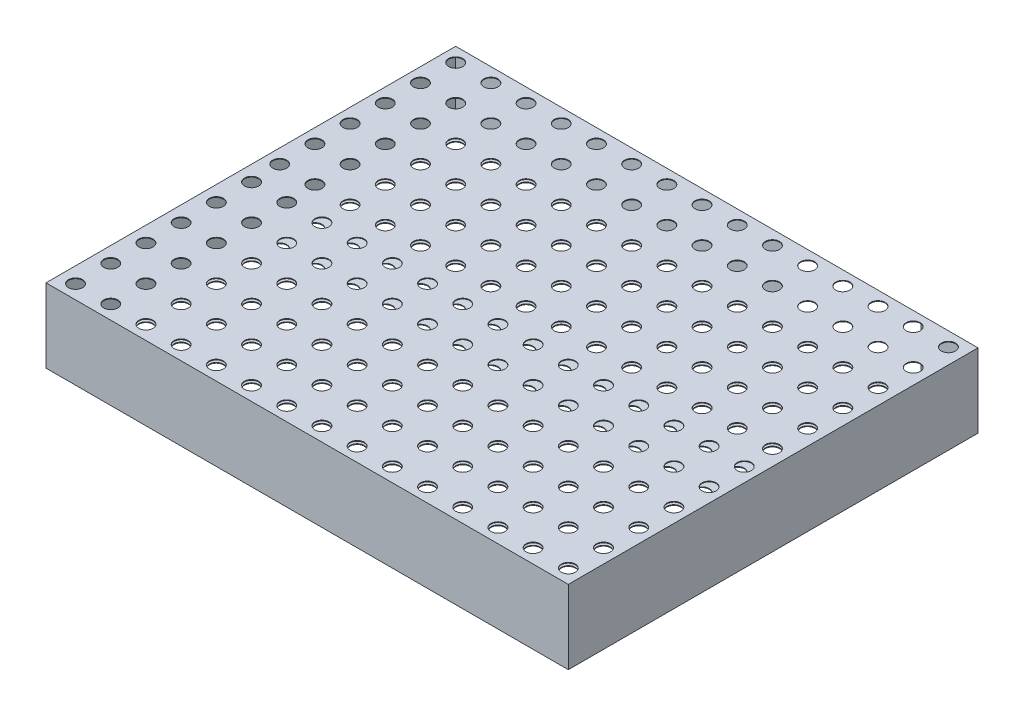
from build123d import *

# Parameters (mm, degrees)
EXTRUDE_1_OUTLINE_W      = 742
EXTRUDE_1_OUTLINE_H      = 582
EXTRUDE_1_DEPTH          = 1
EXTRUDE_START            = 104
EXTRUDE_1_2_OUTLINE_W    = 742
EXTRUDE_1_2_OUTLINE_H    = 582
EXTRUDE_1_2_DEPTH        = 1
EXTRUDE_START_2          = 1
EXTRUDE_1_3_OUTLINE_W    = 742
EXTRUDE_1_3_OUTLINE_H    = 582
EXTRUDE_1_3_OUTLINE_W_2  = 740
EXTRUDE_1_3_OUTLINE_H_2  = 580
EXTRUDE_1_3_DEPTH        = 103
CUT_EXTRUDE_2_DEPTH      = 484.060037676
CUT_EXTRUDE_2_DEPTH_BACK = 484.060037676
SKETCH_5_R               = 10
SKETCH_6_W               = 180
SKETCH_6_H               = 100
CUT_EXTRUDE_3_DEPTH      = 484.060037676


# Read off the part's stored shape, not the designer's step: 拉伸-薄壁1
with BuildPart() as part:
    # 拉伸-薄壁1 outline → 拉伸-薄壁1 (new body)
    with BuildSketch(Plane(origin=(0, 0, 0), x_dir=(1, 0, 0), z_dir=(0, 1, 0))):
        Rectangle(EXTRUDE_1_OUTLINE_W, EXTRUDE_1_OUTLINE_H)
    extrude(amount=EXTRUDE_1_DEPTH)



with BuildPart() as body_2:
    # Extrude 1 2 outline → Extrude 1 2 (new body)
    with BuildSketch(Plane(origin=(0, 0, 0), x_dir=(1, 0, 0), z_dir=(0, 1, 0)).offset(EXTRUDE_START)):
        Rectangle(EXTRUDE_1_2_OUTLINE_W, EXTRUDE_1_2_OUTLINE_H)
    extrude(amount=EXTRUDE_1_2_DEPTH)


with BuildPart() as part_1:
    add(part.part)

    add(body_2.part)  # Extrude 1 3 merges body 2
    # Extrude 1 3 outline → Extrude 1 3 (add)
    with BuildSketch(Plane(origin=(0, 0, 0), x_dir=(1, 0, 0), z_dir=(0, 1, 0)).offset(EXTRUDE_START_2)):
        Rectangle(EXTRUDE_1_3_OUTLINE_W, EXTRUDE_1_3_OUTLINE_H)
        Rectangle(EXTRUDE_1_3_OUTLINE_W_2, EXTRUDE_1_3_OUTLINE_H_2, mode=Mode.SUBTRACT)
    extrude(amount=EXTRUDE_1_3_DEPTH)

    # 草图5 → 切除-拉伸2 (cut, two sides: drawn at the far end of the back side and taken through both)
    with BuildSketch(Plane(origin=(0, 0, 0), x_dir=(1, 0, 0), z_dir=(0, 1, 0)).offset(-CUT_EXTRUDE_2_DEPTH_BACK)):
        with Locations(Location((-351, 271, 0), (0, 0, 270))):
            Circle(SKETCH_5_R)
        with Locations(Location((-301, 271, 0), (0, 0, 270))):
            Circle(SKETCH_5_R)
        with Locations(Location((-251, 271, 0), (0, 0, 270))):
            Circle(SKETCH_5_R)
        with Locations(Location((-201, 271, 0), (0, 0, 270))):
            Circle(SKETCH_5_R)
        with Locations(Location((-151, 271, 0), (0, 0, 270))):
            Circle(SKETCH_5_R)
        with Locations(Location((-101, 271, 0), (0, 0, 270))):
            Circle(SKETCH_5_R)
        with Locations(Location((-51, 271, 0), (0, 0, 270))):
            Circle(SKETCH_5_R)
        with Locations(Location((-1, 271, 0), (0, 0, 270))):
            Circle(SKETCH_5_R)
        with Locations(Location((49, 271, 0), (0, 0, 270))):
            Circle(SKETCH_5_R)
        with Locations(Location((99, 271, 0), (0, 0, 270))):
            Circle(SKETCH_5_R)
        with Locations(Location((149, 271, 0), (0, 0, 270))):
            Circle(SKETCH_5_R)
        with Locations(Location((199, 271, 0), (0, 0, 270))):
            Circle(SKETCH_5_R)
        with Locations(Location((249, 271, 0), (0, 0, 270))):
            Circle(SKETCH_5_R)
        with Locations(Location((299, 271, 0), (0, 0, 270))):
            Circle(SKETCH_5_R)
        with Locations(Location((349, 271, 0), (0, 0, 270))):
            Circle(SKETCH_5_R)
        with Locations(Location((-301, 221, 0), (0, 0, 270))):
            Circle(SKETCH_5_R)
        with Locations(Location((-251, 221, 0), (0, 0, 270))):
            Circle(SKETCH_5_R)
        with Locations(Location((-201, 221, 0), (0, 0, 270))):
            Circle(SKETCH_5_R)
        with Locations(Location((-151, 221, 0), (0, 0, 270))):
            Circle(SKETCH_5_R)
        with Locations(Location((-101, 221, 0), (0, 0, 270))):
            Circle(SKETCH_5_R)
        with Locations(Location((-51, 221, 0), (0, 0, 270))):
            Circle(SKETCH_5_R)
        with Locations(Location((-1, 221, 0), (0, 0, 270))):
            Circle(SKETCH_5_R)
        with Locations(Location((49, 221, 0), (0, 0, 270))):
            Circle(SKETCH_5_R)
        with Locations(Location((99, 221, 0), (0, 0, 270))):
            Circle(SKETCH_5_R)
        with Locations(Location((149, 221, 0), (0, 0, 270))):
            Circle(SKETCH_5_R)
        with Locations(Location((199, 221, 0), (0, 0, 270))):
            Circle(SKETCH_5_R)
        with Locations(Location((249, 221, 0), (0, 0, 270))):
            Circle(SKETCH_5_R)
        with Locations(Location((299, 221, 0), (0, 0, 270))):
            Circle(SKETCH_5_R)
        with Locations(Location((349, 221, 0), (0, 0, 270))):
            Circle(SKETCH_5_R)
        with Locations(Location((-301, 171, 0), (0, 0, 270))):
            Circle(SKETCH_5_R)
        with Locations(Location((-251, 171, 0), (0, 0, 270))):
            Circle(SKETCH_5_R)
        with Locations(Location((-201, 171, 0), (0, 0, 270))):
            Circle(SKETCH_5_R)
        with Locations(Location((-151, 171, 0), (0, 0, 270))):
            Circle(SKETCH_5_R)
        with Locations(Location((-101, 171, 0), (0, 0, 270))):
            Circle(SKETCH_5_R)
        with Locations(Location((-51, 171, 0), (0, 0, 270))):
            Circle(SKETCH_5_R)
        with Locations(Location((-1, 171, 0), (0, 0, 270))):
            Circle(SKETCH_5_R)
        with Locations(Location((49, 171, 0), (0, 0, 270))):
            Circle(SKETCH_5_R)
        with Locations(Location((99, 171, 0), (0, 0, 270))):
            Circle(SKETCH_5_R)
        with Locations(Location((149, 171, 0), (0, 0, 270))):
            Circle(SKETCH_5_R)
        with Locations(Location((199, 171, 0), (0, 0, 270))):
            Circle(SKETCH_5_R)
        with Locations(Location((249, 171, 0), (0, 0, 270))):
            Circle(SKETCH_5_R)
        with Locations(Location((299, 171, 0), (0, 0, 270))):
            Circle(SKETCH_5_R)
        with Locations(Location((349, 171, 0), (0, 0, 270))):
            Circle(SKETCH_5_R)
        with Locations(Location((-301, 121, 0), (0, 0, 270))):
            Circle(SKETCH_5_R)
        with Locations(Location((-251, 121, 0), (0, 0, 270))):
            Circle(SKETCH_5_R)
        with Locations(Location((-201, 121, 0), (0, 0, 270))):
            Circle(SKETCH_5_R)
        with Locations(Location((-151, 121, 0), (0, 0, 270))):
            Circle(SKETCH_5_R)
        with Locations(Location((-101, 121, 0), (0, 0, 270))):
            Circle(SKETCH_5_R)
        with Locations(Location((-51, 121, 0), (0, 0, 270))):
            Circle(SKETCH_5_R)
        with Locations(Location((-1, 121, 0), (0, 0, 270))):
            Circle(SKETCH_5_R)
        with Locations(Location((49, 121, 0), (0, 0, 270))):
            Circle(SKETCH_5_R)
        with Locations(Location((99, 121, 0), (0, 0, 270))):
            Circle(SKETCH_5_R)
        with Locations(Location((149, 121, 0), (0, 0, 270))):
            Circle(SKETCH_5_R)
        with Locations(Location((199, 121, 0), (0, 0, 270))):
            Circle(SKETCH_5_R)
        with Locations(Location((249, 121, 0), (0, 0, 270))):
            Circle(SKETCH_5_R)
        with Locations(Location((299, 121, 0), (0, 0, 270))):
            Circle(SKETCH_5_R)
        with Locations(Location((349, 121, 0), (0, 0, 270))):
            Circle(SKETCH_5_R)
        with Locations(Location((-301, 71, 0), (0, 0, 270))):
            Circle(SKETCH_5_R)
        with Locations(Location((-251, 71, 0), (0, 0, 270))):
            Circle(SKETCH_5_R)
        with Locations(Location((-201, 71, 0), (0, 0, 270))):
            Circle(SKETCH_5_R)
        with Locations(Location((-151, 71, 0), (0, 0, 270))):
            Circle(SKETCH_5_R)
        with Locations(Location((-101, 71, 0), (0, 0, 270))):
            Circle(SKETCH_5_R)
        with Locations(Location((-51, 71, 0), (0, 0, 270))):
            Circle(SKETCH_5_R)
        with Locations(Location((-1, 71, 0), (0, 0, 270))):
            Circle(SKETCH_5_R)
        with Locations(Location((49, 71, 0), (0, 0, 270))):
            Circle(SKETCH_5_R)
        with Locations(Location((99, 71, 0), (0, 0, 270))):
            Circle(SKETCH_5_R)
        with Locations(Location((149, 71, 0), (0, 0, 270))):
            Circle(SKETCH_5_R)
        with Locations(Location((199, 71, 0), (0, 0, 270))):
            Circle(SKETCH_5_R)
        with Locations(Location((249, 71, 0), (0, 0, 270))):
            Circle(SKETCH_5_R)
        with Locations(Location((299, 71, 0), (0, 0, 270))):
            Circle(SKETCH_5_R)
        with Locations(Location((349, 71, 0), (0, 0, 270))):
            Circle(SKETCH_5_R)
        with Locations(Location((-301, 21, 0), (0, 0, 270))):
            Circle(SKETCH_5_R)
        with Locations(Location((-251, 21, 0), (0, 0, 270))):
            Circle(SKETCH_5_R)
        with Locations(Location((-201, 21, 0), (0, 0, 270))):
            Circle(SKETCH_5_R)
        with Locations(Location((-151, 21, 0), (0, 0, 270))):
            Circle(SKETCH_5_R)
        with Locations(Location((-101, 21, 0), (0, 0, 270))):
            Circle(SKETCH_5_R)
        with Locations(Location((-51, 21, 0), (0, 0, 270))):
            Circle(SKETCH_5_R)
        with Locations(Location((-1, 21, 0), (0, 0, 270))):
            Circle(SKETCH_5_R)
        with Locations(Location((49, 21, 0), (0, 0, 270))):
            Circle(SKETCH_5_R)
        with Locations(Location((99, 21, 0), (0, 0, 270))):
            Circle(SKETCH_5_R)
        with Locations(Location((149, 21, 0), (0, 0, 270))):
            Circle(SKETCH_5_R)
        with Locations(Location((199, 21, 0), (0, 0, 270))):
            Circle(SKETCH_5_R)
        with Locations(Location((249, 21, 0), (0, 0, 270))):
            Circle(SKETCH_5_R)
        with Locations(Location((299, 21, 0), (0, 0, 270))):
            Circle(SKETCH_5_R)
        with Locations(Location((349, 21, 0), (0, 0, 270))):
            Circle(SKETCH_5_R)
        with Locations(Location((-351, 221, 0), (0, 0, 270))):
            Circle(SKETCH_5_R)
        with Locations(Location((-351, 171, 0), (0, 0, 270))):
            Circle(SKETCH_5_R)
        with Locations(Location((-351, 121, 0), (0, 0, 270))):
            Circle(SKETCH_5_R)
        with Locations(Location((-351, 71, 0), (0, 0, 270))):
            Circle(SKETCH_5_R)
        with Locations(Location((-351, 21, 0), (0, 0, 270))):
            Circle(SKETCH_5_R)
        with Locations(Location((351, -271, 0), (0, 0, 270))):
            Circle(SKETCH_5_R)
        with Locations(Location((301, -271, 0), (0, 0, 270))):
            Circle(SKETCH_5_R)
        with Locations(Location((251, -271, 0), (0, 0, 270))):
            Circle(SKETCH_5_R)
        with Locations(Location((201, -271, 0), (0, 0, 270))):
            Circle(SKETCH_5_R)
        with Locations(Location((151, -271, 0), (0, 0, 270))):
            Circle(SKETCH_5_R)
        with Locations(Location((101, -271, 0), (0, 0, 270))):
            Circle(SKETCH_5_R)
        with Locations(Location((51, -271, 0), (0, 0, 270))):
            Circle(SKETCH_5_R)
        with Locations(Location((1, -271, 0), (0, 0, 270))):
            Circle(SKETCH_5_R)
        with Locations(Location((-49, -271, 0), (0, 0, 270))):
            Circle(SKETCH_5_R)
        with Locations(Location((-99, -271, 0), (0, 0, 270))):
            Circle(SKETCH_5_R)
        with Locations(Location((-149, -271, 0), (0, 0, 270))):
            Circle(SKETCH_5_R)
        with Locations(Location((-199, -271, 0), (0, 0, 270))):
            Circle(SKETCH_5_R)
        with Locations(Location((-249, -271, 0), (0, 0, 270))):
            Circle(SKETCH_5_R)
        with Locations(Location((-299, -271, 0), (0, 0, 270))):
            Circle(SKETCH_5_R)
        with Locations(Location((-349, -271, 0), (0, 0, 270))):
            Circle(SKETCH_5_R)
        with Locations(Location((301, -221, 0), (0, 0, 270))):
            Circle(SKETCH_5_R)
        with Locations(Location((251, -221, 0), (0, 0, 270))):
            Circle(SKETCH_5_R)
        with Locations(Location((201, -221, 0), (0, 0, 270))):
            Circle(SKETCH_5_R)
        with Locations(Location((151, -221, 0), (0, 0, 270))):
            Circle(SKETCH_5_R)
        with Locations(Location((101, -221, 0), (0, 0, 270))):
            Circle(SKETCH_5_R)
        with Locations(Location((51, -221, 0), (0, 0, 270))):
            Circle(SKETCH_5_R)
        with Locations(Location((1, -221, 0), (0, 0, 270))):
            Circle(SKETCH_5_R)
        with Locations(Location((-49, -221, 0), (0, 0, 270))):
            Circle(SKETCH_5_R)
        with Locations(Location((-99, -221, 0), (0, 0, 270))):
            Circle(SKETCH_5_R)
        with Locations(Location((-149, -221, 0), (0, 0, 270))):
            Circle(SKETCH_5_R)
        with Locations(Location((-199, -221, 0), (0, 0, 270))):
            Circle(SKETCH_5_R)
        with Locations(Location((-249, -221, 0), (0, 0, 270))):
            Circle(SKETCH_5_R)
        with Locations(Location((-299, -221, 0), (0, 0, 270))):
            Circle(SKETCH_5_R)
        with Locations(Location((-349, -221, 0), (0, 0, 270))):
            Circle(SKETCH_5_R)
        with Locations(Location((301, -171, 0), (0, 0, 270))):
            Circle(SKETCH_5_R)
        with Locations(Location((251, -171, 0), (0, 0, 270))):
            Circle(SKETCH_5_R)
        with Locations(Location((201, -171, 0), (0, 0, 270))):
            Circle(SKETCH_5_R)
        with Locations(Location((151, -171, 0), (0, 0, 270))):
            Circle(SKETCH_5_R)
        with Locations(Location((101, -171, 0), (0, 0, 270))):
            Circle(SKETCH_5_R)
        with Locations(Location((51, -171, 0), (0, 0, 270))):
            Circle(SKETCH_5_R)
        with Locations(Location((1, -171, 0), (0, 0, 270))):
            Circle(SKETCH_5_R)
        with Locations(Location((-49, -171, 0), (0, 0, 270))):
            Circle(SKETCH_5_R)
        with Locations(Location((-99, -171, 0), (0, 0, 270))):
            Circle(SKETCH_5_R)
        with Locations(Location((-149, -171, 0), (0, 0, 270))):
            Circle(SKETCH_5_R)
        with Locations(Location((-199, -171, 0), (0, 0, 270))):
            Circle(SKETCH_5_R)
        with Locations(Location((-249, -171, 0), (0, 0, 270))):
            Circle(SKETCH_5_R)
        with Locations(Location((-299, -171, 0), (0, 0, 270))):
            Circle(SKETCH_5_R)
        with Locations(Location((-349, -171, 0), (0, 0, 270))):
            Circle(SKETCH_5_R)
        with Locations(Location((301, -121, 0), (0, 0, 270))):
            Circle(SKETCH_5_R)
        with Locations(Location((251, -121, 0), (0, 0, 270))):
            Circle(SKETCH_5_R)
        with Locations(Location((201, -121, 0), (0, 0, 270))):
            Circle(SKETCH_5_R)
        with Locations(Location((151, -121, 0), (0, 0, 270))):
            Circle(SKETCH_5_R)
        with Locations(Location((101, -121, 0), (0, 0, 270))):
            Circle(SKETCH_5_R)
        with Locations(Location((51, -121, 0), (0, 0, 270))):
            Circle(SKETCH_5_R)
        with Locations(Location((1, -121, 0), (0, 0, 270))):
            Circle(SKETCH_5_R)
        with Locations(Location((-49, -121, 0), (0, 0, 270))):
            Circle(SKETCH_5_R)
        with Locations(Location((-99, -121, 0), (0, 0, 270))):
            Circle(SKETCH_5_R)
        with Locations(Location((-149, -121, 0), (0, 0, 270))):
            Circle(SKETCH_5_R)
        with Locations(Location((-199, -121, 0), (0, 0, 270))):
            Circle(SKETCH_5_R)
        with Locations(Location((-249, -121, 0), (0, 0, 270))):
            Circle(SKETCH_5_R)
        with Locations(Location((-299, -121, 0), (0, 0, 270))):
            Circle(SKETCH_5_R)
        with Locations(Location((-349, -121, 0), (0, 0, 270))):
            Circle(SKETCH_5_R)
        with Locations(Location((301, -71, 0), (0, 0, 270))):
            Circle(SKETCH_5_R)
        with Locations(Location((251, -71, 0), (0, 0, 270))):
            Circle(SKETCH_5_R)
        with Locations(Location((201, -71, 0), (0, 0, 270))):
            Circle(SKETCH_5_R)
        with Locations(Location((151, -71, 0), (0, 0, 270))):
            Circle(SKETCH_5_R)
        with Locations(Location((101, -71, 0), (0, 0, 270))):
            Circle(SKETCH_5_R)
        with Locations(Location((51, -71, 0), (0, 0, 270))):
            Circle(SKETCH_5_R)
        with Locations(Location((1, -71, 0), (0, 0, 270))):
            Circle(SKETCH_5_R)
        with Locations(Location((-49, -71, 0), (0, 0, 270))):
            Circle(SKETCH_5_R)
        with Locations(Location((-99, -71, 0), (0, 0, 270))):
            Circle(SKETCH_5_R)
        with Locations(Location((-149, -71, 0), (0, 0, 270))):
            Circle(SKETCH_5_R)
        with Locations(Location((-199, -71, 0), (0, 0, 270))):
            Circle(SKETCH_5_R)
        with Locations(Location((-249, -71, 0), (0, 0, 270))):
            Circle(SKETCH_5_R)
        with Locations(Location((-299, -71, 0), (0, 0, 270))):
            Circle(SKETCH_5_R)
        with Locations(Location((-349, -71, 0), (0, 0, 270))):
            Circle(SKETCH_5_R)
        with Locations(Location((301, -21, 0), (0, 0, 270))):
            Circle(SKETCH_5_R)
        with Locations(Location((251, -21, 0), (0, 0, 270))):
            Circle(SKETCH_5_R)
        with Locations(Location((201, -21, 0), (0, 0, 270))):
            Circle(SKETCH_5_R)
        with Locations(Location((151, -21, 0), (0, 0, 270))):
            Circle(SKETCH_5_R)
        with Locations(Location((101, -21, 0), (0, 0, 270))):
            Circle(SKETCH_5_R)
        with Locations(Location((51, -21, 0), (0, 0, 270))):
            Circle(SKETCH_5_R)
        with Locations(Location((1, -21, 0), (0, 0, 270))):
            Circle(SKETCH_5_R)
        with Locations(Location((-49, -21, 0), (0, 0, 270))):
            Circle(SKETCH_5_R)
        with Locations(Location((-99, -21, 0), (0, 0, 270))):
            Circle(SKETCH_5_R)
        with Locations(Location((-149, -21, 0), (0, 0, 270))):
            Circle(SKETCH_5_R)
        with Locations(Location((-199, -21, 0), (0, 0, 270))):
            Circle(SKETCH_5_R)
        with Locations(Location((-249, -21, 0), (0, 0, 270))):
            Circle(SKETCH_5_R)
        with Locations(Location((-299, -21, 0), (0, 0, 270))):
            Circle(SKETCH_5_R)
        with Locations(Location((-349, -21, 0), (0, 0, 270))):
            Circle(SKETCH_5_R)
        with Locations(Location((351, -221, 0), (0, 0, 270))):
            Circle(SKETCH_5_R)
        with Locations(Location((351, -171, 0), (0, 0, 270))):
            Circle(SKETCH_5_R)
        with Locations(Location((351, -121, 0), (0, 0, 270))):
            Circle(SKETCH_5_R)
        with Locations(Location((351, -71, 0), (0, 0, 270))):
            Circle(SKETCH_5_R)
        with Locations(Location((351, -21, 0), (0, 0, 270))):
            Circle(SKETCH_5_R)
    extrude(amount=CUT_EXTRUDE_2_DEPTH + CUT_EXTRUDE_2_DEPTH_BACK, mode=Mode.SUBTRACT)

    # 草图6 → 切除-拉伸3 (cut, through all)
    with BuildSketch(Plane.XY):
        with Locations((201, 52.5)):
            Rectangle(SKETCH_6_W, SKETCH_6_H)
    extrude(amount=-CUT_EXTRUDE_3_DEPTH, mode=Mode.SUBTRACT)


solid = part_1.part
